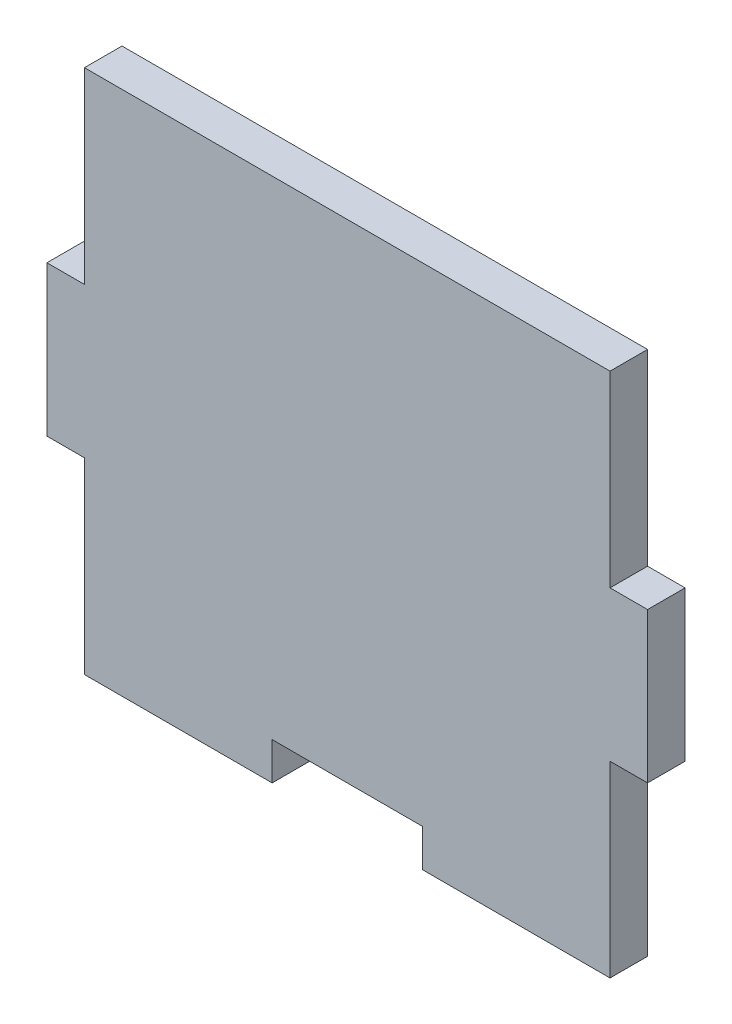
from build123d import *

# Parameters (mm, degrees)
BOSS_EXTRUDE1_DEPTH = 6.35


with BuildPart() as part:
    # Sketch1 → Boss-Extrude1 (new body)
    with BuildSketch(Plane.XY):
        Polygon((-20.155666918, 59.334231645), (-109.055666918, 59.334231645), (-109.055666918, 27.584231645), (-115.405666918, 27.584231645), (-115.405666918, 2.184231645), (-109.055666918, 2.184231645), (-109.055666918, -29.565768355), (-77.305666918, -29.565768355), (-77.305666918, -23.215768355), (-51.905666918, -23.215768355), (-51.905666918, -29.565768355), (-20.155666918, -29.565768355), (-20.155666918, 2.184231645), (-13.805666918, 2.184231645), (-13.805666918, 27.584231645), (-20.155666918, 27.584231645), align=None)
    extrude(amount=BOSS_EXTRUDE1_DEPTH)


solid = part.part
